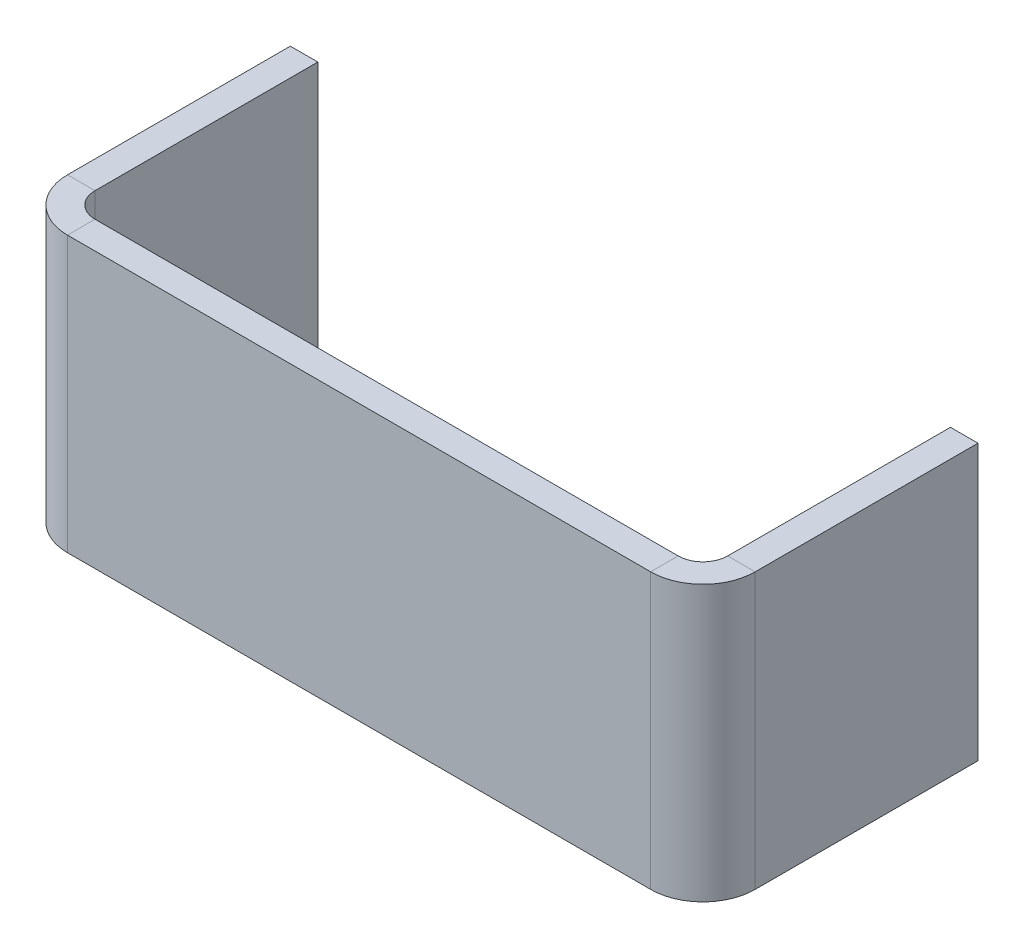
from build123d import *

# Parameters (mm, degrees)
SKETCH1_W                      = 50
SKETCH1_H                      = 20
BASE_FLANGE1_DEPTH             = 2
EDGE_FLANGE1_STRIP_W           = 11.6
EDGE_FLANGE1_STRIP_H           = 2
EDGE_FLANGE1_STRIP_CUT_DEPTH   = 20
EDGE_FLANGE1_STRIP_2_W         = 11.6
EDGE_FLANGE1_STRIP_2_H         = 2
EDGE_FLANGE1_STRIP_CUT_2_DEPTH = 20
EDGE_FLANGE1_DEPTH             = 20
EDGE_FLANGE1_BEND_DEPTH        = 20


# Sheet-metal steps are written as plain solids
with BuildPart() as part:
    # Sketch1 → Base-Flange1 (new body)
    with BuildSketch(Plane.XY):
        with Locations((24.146981627, 10)):
            Rectangle(SKETCH1_W, SKETCH1_H)
    extrude(amount=-BASE_FLANGE1_DEPTH)

    # Edge-Flange1 strip (across the edge) → Edge-Flange1 strip cut (cut)
    with BuildSketch(Plane(origin=(-0.853018373, 0, -2), x_dir=(1, 0, 0), z_dir=(0, 1, 0))):
        with Locations((-2, -1)):
            Rectangle(EDGE_FLANGE1_STRIP_W, EDGE_FLANGE1_STRIP_H)
    extrude(amount=EDGE_FLANGE1_STRIP_CUT_DEPTH, mode=Mode.SUBTRACT)

    # Edge-Flange1 strip 2 (across the edge) → Edge-Flange1 strip cut 2 (cut)
    with BuildSketch(Plane(origin=(49.146981627, 20, -2), x_dir=(-1, 0, 0), z_dir=(0, -1, 0))):
        with Locations((-2, -1)):
            Rectangle(EDGE_FLANGE1_STRIP_2_W, EDGE_FLANGE1_STRIP_2_H)
    extrude(amount=EDGE_FLANGE1_STRIP_CUT_2_DEPTH, mode=Mode.SUBTRACT)

    # Edge-Flange1 section (across the edge) → Edge-Flange1 (add)
    with BuildSketch(Plane(origin=(-0.853018373, 0, -2), x_dir=(1, 0, 0), z_dir=(0, 1, 0))):
        with BuildLine():
            Line((0, 1.8), (0, 18))
            Line((0, 18), (2, 18))
            Line((2, 18), (2, 1.8))
            ThreePointArc((2, 1.8), (2.527207794, 0.527207794), (3.8, 0))
            Line((3.8, 0), (3.8, -2))
            ThreePointArc((3.8, -2), (1.112994231, -0.887005769), (0, 1.8))
        make_face()
    extrude(amount=EDGE_FLANGE1_DEPTH)

    # Edge-Flange1 section 2 (across the edge) → Edge-Flange1 bend (add)
    with BuildSketch(Plane(origin=(49.146981627, 20, -2), x_dir=(-1, 0, 0), z_dir=(0, -1, 0))):
        with BuildLine():
            Line((0, 1.8), (0, 18))
            Line((0, 18), (2, 18))
            Line((2, 18), (2, 1.8))
            ThreePointArc((2, 1.8), (2.527207794, 0.527207794), (3.8, 0))
            Line((3.8, 0), (3.8, -2))
            ThreePointArc((3.8, -2), (1.112994231, -0.887005769), (0, 1.8))
        make_face()
    extrude(amount=EDGE_FLANGE1_BEND_DEPTH)


solid = part.part
